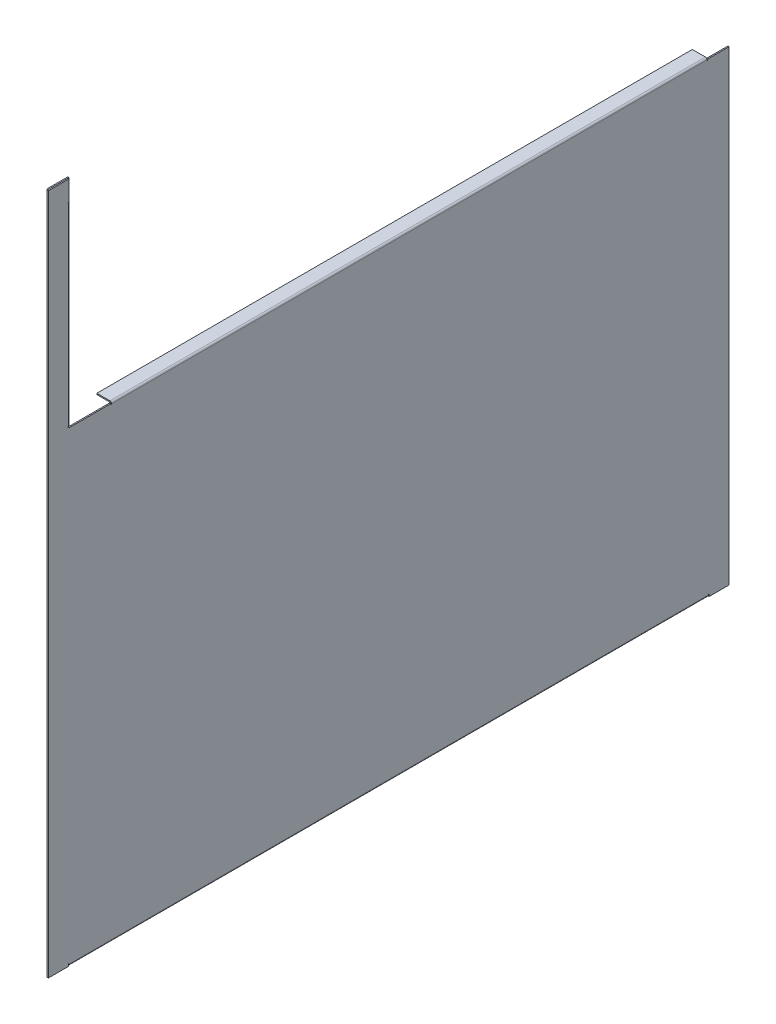
from build123d import *

# Parameters (mm, degrees)
BASE_FLANGE2_DEPTH            = 1.7366
EDGE_FLANGE5_STRIP_W          = 8.4196
EDGE_FLANGE5_STRIP_H          = 1.7366
EDGE_FLANGE5_STRIP_CUT_DEPTH  = 939.6
EDGE_FLANGE5_RELIEF_W         = 9.2879
EDGE_FLANGE5_RELIEF_H         = 0.8683
EDGE_FLANGE5_RELIEF_CUT_DEPTH = 1.7366
EDGE_FLANGE5_DEPTH            = 939.6
EDGE_FLANGE6_STRIP_W          = 8.4196
EDGE_FLANGE6_STRIP_H          = 1.7366
EDGE_FLANGE6_STRIP_CUT_DEPTH  = 284.5
EDGE_FLANGE6_RELIEF_W         = 9.2879
EDGE_FLANGE6_RELIEF_H         = 0.8683
EDGE_FLANGE6_RELIEF_CUT_DEPTH = 1.7366
EDGE_FLANGE6_DEPTH            = 284.5
EDGE_FLANGE8_STRIP_W          = 8.4196
EDGE_FLANGE8_STRIP_H          = 1.7366
EDGE_FLANGE8_STRIP_CUT_DEPTH  = 874.9634
EDGE_FLANGE8_RELIEF_W         = 9.2879
EDGE_FLANGE8_RELIEF_H         = 0.8683
EDGE_FLANGE8_RELIEF_CUT_DEPTH = 1.7366
EDGE_FLANGE8_DEPTH            = 874.9634
EDGE_FLANGE9_STRIP_W          = 8.4196
EDGE_FLANGE9_STRIP_H          = 1.7366
EDGE_FLANGE9_STRIP_CUT_DEPTH  = 284.3634
EDGE_FLANGE9_RELIEF_W         = 9.2879
EDGE_FLANGE9_RELIEF_H         = 0.8683
EDGE_FLANGE9_RELIEF_CUT_DEPTH = 1.7366
EDGE_FLANGE9_DEPTH            = 284.3634


# Sheet-metal steps are written as plain solids
with BuildPart() as part:
    # Sketch10 → Base-Flange2 (new body)
    with BuildSketch(Plane(origin=(0, 0, 0), x_dir=(0, 0, -1), z_dir=(1, 0, 0))):
        Polygon((-470.9, 501), (-470.9, 184.3), (499, 184.3), (499, -500.7), (-501, -500.7), (-501, 501), align=None)
    extrude(amount=-BASE_FLANGE2_DEPTH)

    # Edge-Flange5 strip (across the edge) → Edge-Flange5 strip cut (cut)
    with BuildSketch(Plane(origin=(-1.7366, -500.7, -468.8), x_dir=(0, 1, 0), z_dir=(0, 0, 1))):
        with Locations((-1.7366, -0.8683)):
            Rectangle(EDGE_FLANGE5_STRIP_W, EDGE_FLANGE5_STRIP_H)
    extrude(amount=EDGE_FLANGE5_STRIP_CUT_DEPTH, mode=Mode.SUBTRACT)

    # Edge-Flange5 relief (on the sheet) → Edge-Flange5 relief cut (cut)
    with BuildSketch(Plane(origin=(-1.7366, -498.2268, -468.8), x_dir=(0, 1, 0), z_dir=(-1, 0, 0))):
        with Locations((-3.77565, 0.43415)):
            Rectangle(EDGE_FLANGE5_RELIEF_W, EDGE_FLANGE5_RELIEF_H)
        with Locations((-3.77565, -940.03415)):
            Rectangle(EDGE_FLANGE5_RELIEF_W, EDGE_FLANGE5_RELIEF_H)
    extrude(amount=-EDGE_FLANGE5_RELIEF_CUT_DEPTH, mode=Mode.SUBTRACT)

    # Edge-Flange5 section (across the edge) → Edge-Flange5 (add)
    with BuildSketch(Plane(origin=(-1.7366, -500.7, -468.8), x_dir=(0, 1, 0), z_dir=(0, 0, 1))):
        with BuildLine():
            Line((0, 0.7366), (0, 28.2634))
            Line((0, 28.2634), (1.7366, 28.2634))
            Line((1.7366, 28.2634), (1.7366, 0.7366))
            ThreePointArc((1.7366, 0.7366), (1.952345145, 0.215745145), (2.4732, 0))
            Line((2.4732, 0), (2.4732, -1.7366))
            ThreePointArc((2.4732, -1.7366), (0.724383509, -1.012216491), (0, 0.7366))
        make_face()
    extrude(amount=EDGE_FLANGE5_DEPTH)

    # Edge-Flange6 strip (across the edge) → Edge-Flange6 strip cut (cut)
    with BuildSketch(Plane(origin=(-1.7366, 470.8, 470.9), x_dir=(0, 0, 1), z_dir=(0, -1, 0))):
        with Locations((-3.4732, -0.8683)):
            Rectangle(EDGE_FLANGE6_STRIP_W, EDGE_FLANGE6_STRIP_H)
    extrude(amount=EDGE_FLANGE6_STRIP_CUT_DEPTH, mode=Mode.SUBTRACT)

    # Edge-Flange6 relief (on the sheet) → Edge-Flange6 relief cut (cut)
    with BuildSketch(Plane(origin=(-1.7366, 470.8, 471.6366), x_dir=(0, 0, 1), z_dir=(-1, 0, 0))):
        with Locations((-3.77565, 0.43415)):
            Rectangle(EDGE_FLANGE6_RELIEF_W, EDGE_FLANGE6_RELIEF_H)
        with Locations((-3.77565, -284.93415)):
            Rectangle(EDGE_FLANGE6_RELIEF_W, EDGE_FLANGE6_RELIEF_H)
    extrude(amount=-EDGE_FLANGE6_RELIEF_CUT_DEPTH, mode=Mode.SUBTRACT)

    # Edge-Flange6 section (across the edge) → Edge-Flange6 (add)
    with BuildSketch(Plane(origin=(-1.7366, 470.8, 470.9), x_dir=(0, 0, 1), z_dir=(0, -1, 0))):
        with BuildLine():
            Line((-1.7366, 0.7366), (-1.7366, 30.2))
            Line((-1.7366, 30.2), (0, 30.2))
            Line((0, 30.2), (0, 0.7366))
            ThreePointArc((0, 0.7366), (0.215745145, 0.215745145), (0.7366, 0))
            Line((0.7366, 0), (0.7366, -1.7366))
            ThreePointArc((0.7366, -1.7366), (-1.012216491, -1.012216491), (-1.7366, 0.7366))
        make_face()
    extrude(amount=EDGE_FLANGE6_DEPTH)

    # Edge-Flange8 strip (across the edge) → Edge-Flange8 strip cut (cut)
    with BuildSketch(Plane(origin=(-1.7366, 184.3, 408.1634), x_dir=(0, -1, 0), z_dir=(0, 0, -1))):
        with Locations((-3.4732, -0.8683)):
            Rectangle(EDGE_FLANGE8_STRIP_W, EDGE_FLANGE8_STRIP_H)
    extrude(amount=EDGE_FLANGE8_STRIP_CUT_DEPTH, mode=Mode.SUBTRACT)

    # Edge-Flange8 relief (on the sheet) → Edge-Flange8 relief cut (cut)
    with BuildSketch(Plane(origin=(-1.7366, 183.5634, 408.1634), x_dir=(0, -1, 0), z_dir=(-1, 0, 0))):
        with Locations((-3.77565, 0.43415)):
            Rectangle(EDGE_FLANGE8_RELIEF_W, EDGE_FLANGE8_RELIEF_H)
        with Locations((-3.77565, -875.39755)):
            Rectangle(EDGE_FLANGE8_RELIEF_W, EDGE_FLANGE8_RELIEF_H)
    extrude(amount=-EDGE_FLANGE8_RELIEF_CUT_DEPTH, mode=Mode.SUBTRACT)

    # Edge-Flange8 section (across the edge) → Edge-Flange8 (add)
    with BuildSketch(Plane(origin=(-1.7366, 184.3, 408.1634), x_dir=(0, -1, 0), z_dir=(0, 0, -1))):
        with BuildLine():
            Line((-1.7366, 0.7366), (-1.7366, 20))
            Line((-1.7366, 20), (0, 20))
            Line((0, 20), (0, 0.7366))
            ThreePointArc((0, 0.7366), (0.215745145, 0.215745145), (0.7366, 0))
            Line((0.7366, 0), (0.7366, -1.7366))
            ThreePointArc((0.7366, -1.7366), (-1.012216491, -1.012216491), (-1.7366, 0.7366))
        make_face()
    extrude(amount=EDGE_FLANGE8_DEPTH)

    # Edge-Flange9 strip (across the edge) → Edge-Flange9 strip cut (cut)
    with BuildSketch(Plane(origin=(-31.9366, 186.4366, 469.1634), x_dir=(1, 0, 0), z_dir=(0, 1, 0))):
        with Locations((-3.4732, -0.8683)):
            Rectangle(EDGE_FLANGE9_STRIP_W, EDGE_FLANGE9_STRIP_H)
    extrude(amount=EDGE_FLANGE9_STRIP_CUT_DEPTH, mode=Mode.SUBTRACT)

    # Edge-Flange9 relief (on the sheet) → Edge-Flange9 relief cut (cut)
    with BuildSketch(Plane(origin=(-31.2, 186.4366, 469.1634), x_dir=(1, 0, 0), z_dir=(0, 0, -1))):
        with Locations((-3.77565, 0.43415)):
            Rectangle(EDGE_FLANGE9_RELIEF_W, EDGE_FLANGE9_RELIEF_H)
    extrude(amount=-EDGE_FLANGE9_RELIEF_CUT_DEPTH, mode=Mode.SUBTRACT)

    # Edge-Flange9 section (across the edge) → Edge-Flange9 (add)
    with BuildSketch(Plane(origin=(-31.9366, 186.4366, 469.1634), x_dir=(1, 0, 0), z_dir=(0, 1, 0))):
        with BuildLine():
            Line((-1.7366, 0.7366), (-1.7366, 30.2))
            Line((-1.7366, 30.2), (0, 30.2))
            Line((0, 30.2), (0, 0.7366))
            ThreePointArc((0, 0.7366), (0.215745145, 0.215745145), (0.7366, 0))
            Line((0.7366, 0), (0.7366, -1.7366))
            ThreePointArc((0.7366, -1.7366), (-1.012216491, -1.012216491), (-1.7366, 0.7366))
        make_face()
    extrude(amount=EDGE_FLANGE9_DEPTH)


solid = part.part
